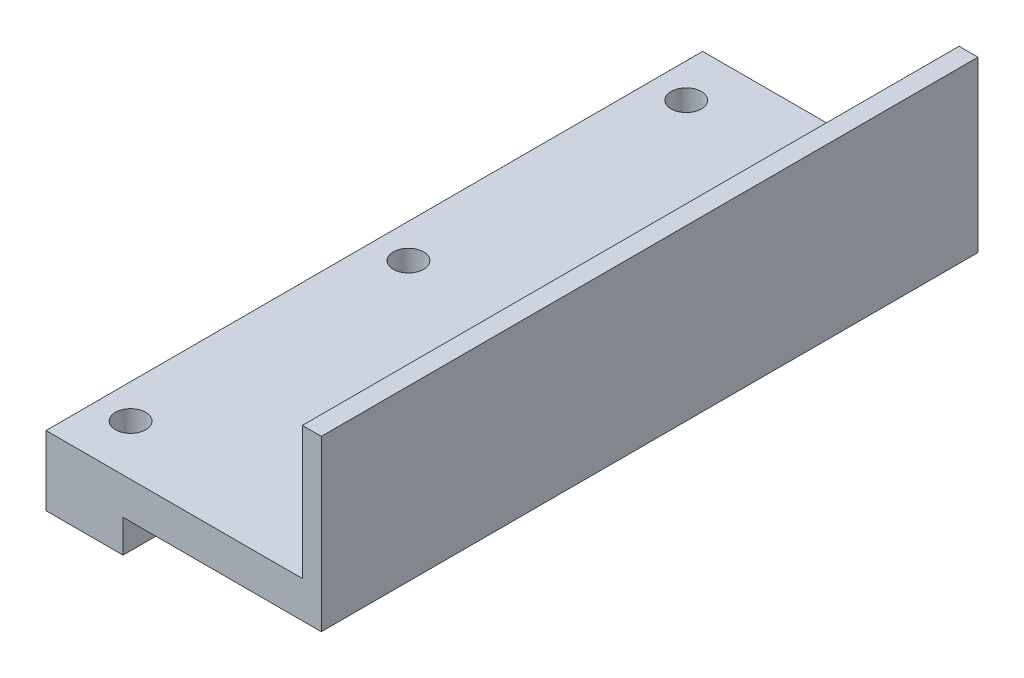
from build123d import *

# Parameters (mm, degrees)
BOSS_EXTRUDE2_DEPTH     = 26
CUT_EXTRUDE2_DEPTH      = 34.441590871
CUT_EXTRUDE2_DEPTH_BACK = 34.441590871
SKETCH2_R               = 1.2
SKETCH3_W               = 52
SKETCH3_H               = 13.4
BOSS_EXTRUDE3_DEPTH     = 1.5


with BuildPart() as part:
    # Sketch1 → Boss-Extrude2 (new, symmetric)
    with BuildSketch(Plane.XY):
        Polygon((0, 0), (6.1, 0), (6.1, 2.6), (20.3, 2.6), (20.3, 5.5), (0, 5.5), align=None)
    extrude(amount=BOSS_EXTRUDE2_DEPTH, both=True)

    # Sketch2 → Cut-Extrude2 (cut, two sides: drawn at the far end of the back side and taken through both)
    with BuildSketch(Plane(origin=(0, 0, 0), x_dir=(1, 0, 0), z_dir=(0, 1, 0)).offset(-CUT_EXTRUDE2_DEPTH_BACK)):
        with Locations((2.7, 22)):
            Circle(SKETCH2_R)
        with Locations((2.7, 0)):
            Circle(SKETCH2_R)
        with Locations((2.7, -22)):
            Circle(SKETCH2_R)
    extrude(amount=CUT_EXTRUDE2_DEPTH + CUT_EXTRUDE2_DEPTH_BACK, mode=Mode.SUBTRACT)

    # Sketch3 → Boss-Extrude3 (add)
    with BuildSketch(Plane(origin=(20.3, 0, 0), x_dir=(0, 0, -1), z_dir=(1, 0, 0))):
        with Locations((0, 9.3)):
            Rectangle(SKETCH3_W, SKETCH3_H)
    extrude(amount=BOSS_EXTRUDE3_DEPTH)


solid = part.part
